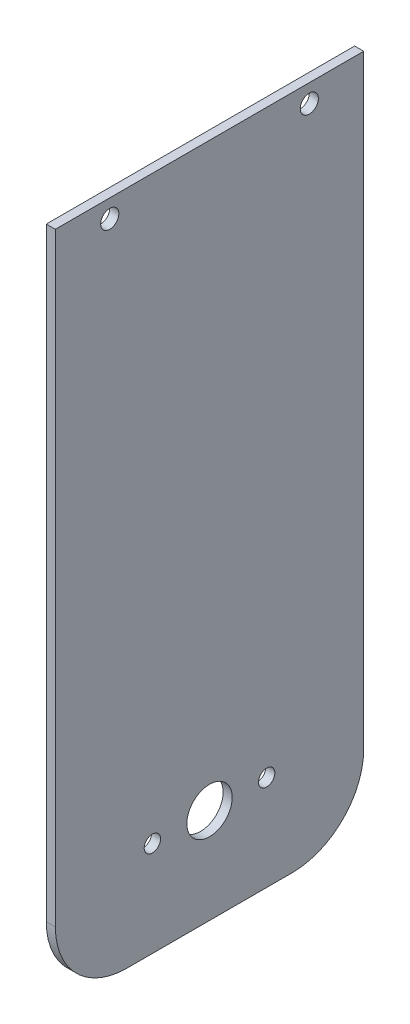
from build123d import *

# Parameters (mm, degrees)
SKETCH1_W           = 107.95
SKETCH1_H           = 236.535
SKETCH1_R           = 7.94
SKETCH1_R_2         = 2.86
SKETCH1_R_3         = 3.175
BOSS_EXTRUDE1_DEPTH = 3.175
FILLET1_R           = 25


with BuildPart() as part:
    # Sketch1 → Boss-Extrude1 (new body)
    with BuildSketch(Plane(origin=(0, 0, 0), x_dir=(0, 0, -1), z_dir=(1, 0, 0))):
        Rectangle(SKETCH1_W, SKETCH1_H)
        with Locations((0, -84.9275)):
            Circle(SKETCH1_R, mode=Mode.SUBTRACT)
        with Locations((20, -84.9275)):
            Circle(SKETCH1_R_2, mode=Mode.SUBTRACT)
        with Locations((-20, -84.9275)):
            Circle(SKETCH1_R_2, mode=Mode.SUBTRACT)
        with Locations((-34.925, 111.9175)):
            Circle(SKETCH1_R_3, mode=Mode.SUBTRACT)
        with Locations((34.925, 111.9175)):
            Circle(SKETCH1_R_3, mode=Mode.SUBTRACT)
    extrude(amount=BOSS_EXTRUDE1_DEPTH)

    # Fillet1
    fillet1_edges = [part.edges().sort_by_distance(p)[0] for p in [
        (1.5875, -118.2675, 53.975),
        (1.5875, -118.2675, -53.975),
    ]]
    fillet(fillet1_edges, radius=FILLET1_R)


solid = part.part
